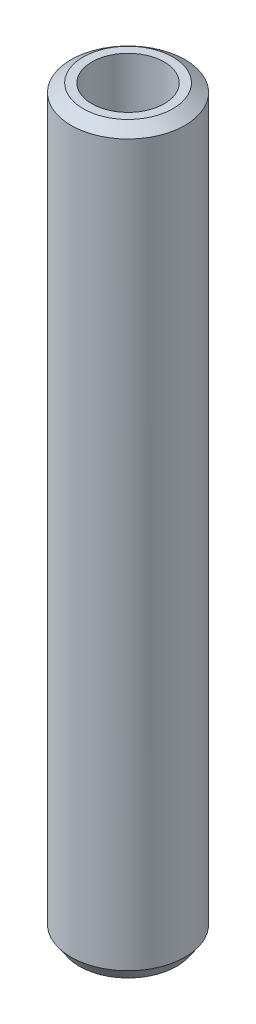
from build123d import *
from OCP.BRepFilletAPI import BRepFilletAPI_MakeChamfer

# Parameters (mm, degrees)
SKETCH1_R           = 12.5
BOSS_EXTRUDE1_DEPTH = 162.45604229
SKETCH2_R           = 7.942882656
CUT_EXTRUDE1_DEPTH  = 164.415010561
CHAMFER1_SIZE       = 1.831857559
CHAMFER1_SIZE2      = 2.665985429


with BuildPart() as part:
    # Sketch1 → Boss-Extrude1 (new body)
    with BuildSketch(Plane(origin=(0, 0, 0), x_dir=(1, 0, 0), z_dir=(0, 1, 0))):
        Circle(SKETCH1_R)
    extrude(amount=BOSS_EXTRUDE1_DEPTH)

    # Sketch2 → Cut-Extrude1 (cut, through all)
    with BuildSketch(Plane(origin=(0, 0, 0), x_dir=(1, 0, 0), z_dir=(0, 1, 0))):
        Circle(SKETCH2_R)
    extrude(amount=CUT_EXTRUDE1_DEPTH, mode=Mode.SUBTRACT)

    # Chamfer1: one chamfer whose edges measure the first distance from different faces: ONE call of the kernel's chamfer builder (chamfer() names one face for all edges)
    chamfer1_edges_1 = [part.edges().sort_by_distance(p)[0] for p in [
        (-12.5, 162.45604229, 0),
    ]]
    chamfer1_side_1 = [part.faces().sort_by_distance(p)[0] for p in [
        (-12.5, 81.228021145, 0),
    ]]
    chamfer1_edges_2 = [part.edges().sort_by_distance(p)[0] for p in [
        (-12.5, 0, 0),
    ]]
    chamfer1_side_2 = [part.faces().sort_by_distance(p)[0] for p in [
        (-12.146446609, 0, 0),
    ]]
    chamfer1 = BRepFilletAPI_MakeChamfer(part.part.solid().wrapped)
    for e in chamfer1_edges_1:
        chamfer1.Add(CHAMFER1_SIZE, CHAMFER1_SIZE2, e.wrapped, chamfer1_side_1[0].wrapped)  # the first distance lies on this face
    for e in chamfer1_edges_2:
        chamfer1.Add(CHAMFER1_SIZE, CHAMFER1_SIZE2, e.wrapped, chamfer1_side_2[0].wrapped)  # the first distance lies on this face
    add(Compound.cast(chamfer1.Shape()), mode=Mode.REPLACE)


solid = part.part
